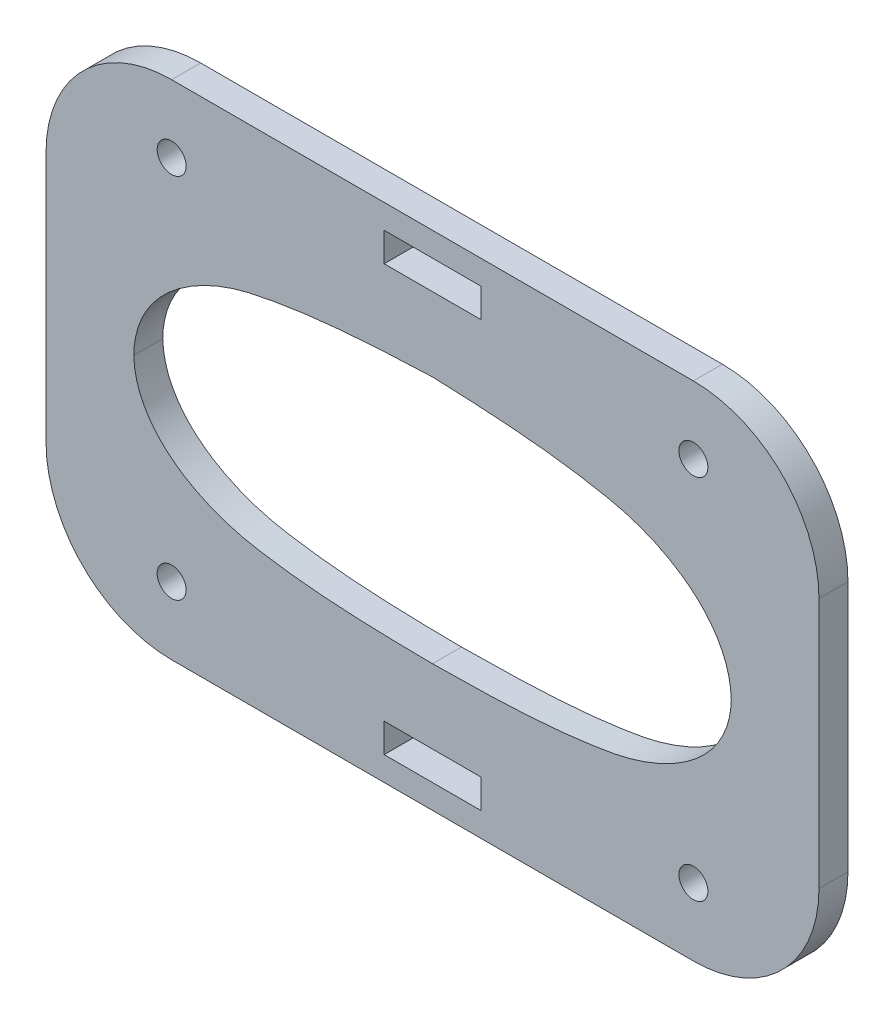
from build123d import *

# Parameters (mm, degrees)
ESBO_O1_R                = 1.5
ESBO_O1_W                = 10
ESBO_O1_H                = 3
RESSALTO_EXTRUS_O1_DEPTH = 3


with BuildPart() as part:
    # Esboço1 → Ressalto-extrusão1 (new body)
    with BuildSketch(Plane.XY):
        with BuildLine():
            Line((27, 26.67462883), (-27, 26.67462883))
            ThreePointArc((-27, 26.67462883), (-36.192388155, 22.867016985), (-40, 13.67462883))
            Line((-40, 13.67462883), (-40, -12.32537117))
            ThreePointArc((-40, -12.32537117), (-36.192388155, -21.517759326), (-27, -25.32537117))
            Line((-27, -25.32537117), (27, -25.32537117))
            ThreePointArc((27, -25.32537117), (36.192388155, -21.517759326), (40, -12.32537117))
            Line((40, -12.32537117), (40, 13.67462883))
            ThreePointArc((40, 13.67462883), (36.192388155, 22.867016985), (27, 26.67462883))
        make_face()
        with Locations((27, -18.32537117)):
            Circle(ESBO_O1_R, mode=Mode.SUBTRACT)
        with Locations((-27, -18.32537117)):
            Circle(ESBO_O1_R, mode=Mode.SUBTRACT)
        with Locations((27, 19.67462883)):
            Circle(ESBO_O1_R, mode=Mode.SUBTRACT)
        with Locations((-27, 19.67462883)):
            Circle(ESBO_O1_R, mode=Mode.SUBTRACT)
        with Locations((0, -21.32537117)):
            Rectangle(ESBO_O1_W, ESBO_O1_H, mode=Mode.SUBTRACT)
        with Locations((0, 22.67462883)):
            Rectangle(ESBO_O1_W, ESBO_O1_H, mode=Mode.SUBTRACT)
        with BuildLine():
            add(Edge.make_bspline(
                [(0, 13.52800581), (-6.244479207, 13.288234114), (-12.519024876, 12.967406591), (-24.729426481, 10.351573244), (-30.828882804, 6.291678687), (-30.923326902, 0)],
                knots=[0, 0, 0, 0, 0.5, 0.5, 1, 1, 1, 1], degree=3))
            add(Edge.make_bspline(
                [(-30.923326902, 0), (-30.740150744, -6.181351573), (-24.460961859, -9.854903261), (-12.334591232, -11.984454717), (-6.155571444, -12.112058494), (0, -12.17874815)],
                knots=[0, 0, 0, 0, 0.5, 0.5, 1, 1, 1, 1], degree=3))
            add(Edge.make_bspline(
                [(30.923326902, 0), (30.740150744, -6.181351573), (24.460961859, -9.854903261), (12.334591232, -11.984454717), (6.155571444, -12.112058494), (0, -12.17874815)],
                knots=[0, 0, 0, 0, 0.5, 0.5, 1, 1, 1, 1], degree=3))
            add(Edge.make_bspline(
                [(0, 13.52800581), (6.244479207, 13.288234114), (12.519024876, 12.967406591), (24.729426481, 10.351573244), (30.828882804, 6.291678687), (30.923326902, 0)],
                knots=[0, 0, 0, 0, 0.5, 0.5, 1, 1, 1, 1], degree=3))
        make_face(mode=Mode.SUBTRACT)
    extrude(amount=RESSALTO_EXTRUS_O1_DEPTH)


solid = part.part
